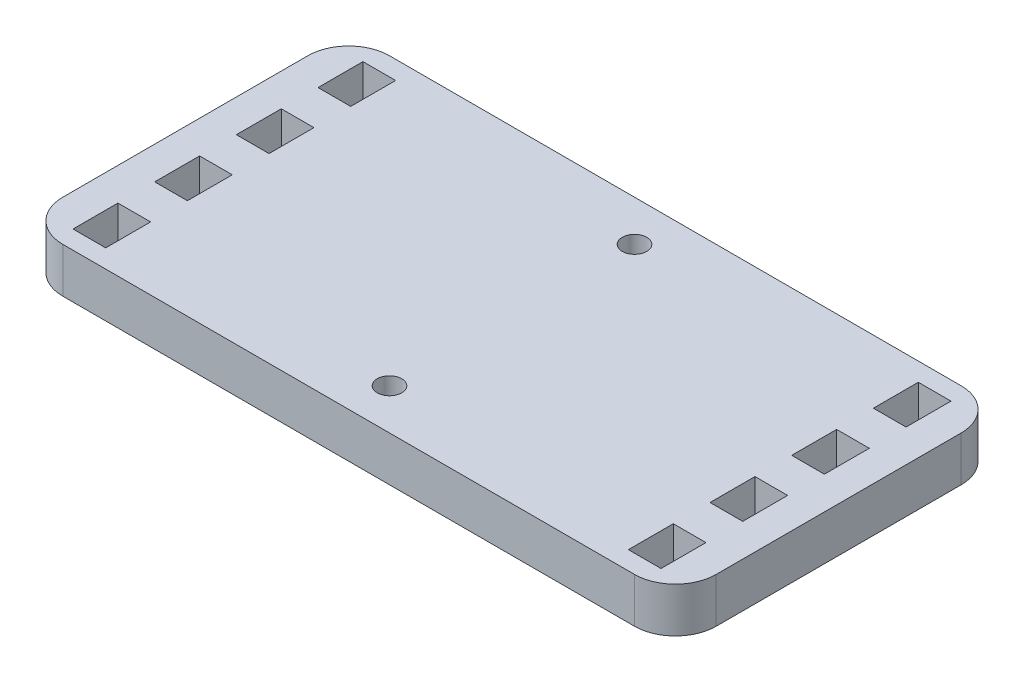
from build123d import *

# Parameters (mm, degrees)
SKETCH1_W           = 80
SKETCH1_H           = 40
SKETCH1_R           = 1.5
BOSS_EXTRUDE1_DEPTH = 5.5
SKETCH2_W           = 4
SKETCH2_H           = 5.5
CUT_EXTRUDE1_DEPTH  = 46.058295574
FILLET1_R           = 5


with BuildPart() as part:
    # Sketch1 → Boss-Extrude1 (new body)
    with BuildSketch(Plane(origin=(0, 0, 0), x_dir=(1, 0, 0), z_dir=(0, 1, 0))):
        Rectangle(SKETCH1_W, SKETCH1_H)
        with Locations((0, 15)):
            Circle(SKETCH1_R, mode=Mode.SUBTRACT)
        with Locations((0, -15)):
            Circle(SKETCH1_R, mode=Mode.SUBTRACT)
    extrude(amount=BOSS_EXTRUDE1_DEPTH)

    # Sketch2 → Cut-Extrude1 (cut, through all)
    with BuildSketch(Plane(origin=(0, 5.5, 0), x_dir=(1, 0, 0), z_dir=(0, 1, 0))):
        with Locations((-34, 5)):
            Rectangle(SKETCH2_W, SKETCH2_H)
        with Locations((-34, 15)):
            Rectangle(SKETCH2_W, SKETCH2_H)
        with Locations((-34, -5)):
            Rectangle(SKETCH2_W, SKETCH2_H)
        with Locations((-34, -15)):
            Rectangle(SKETCH2_W, SKETCH2_H)
        with Locations((34, -15)):
            Rectangle(SKETCH2_W, SKETCH2_H)
        with Locations((34, 15)):
            Rectangle(SKETCH2_W, SKETCH2_H)
        with Locations((34, -5)):
            Rectangle(SKETCH2_W, SKETCH2_H)
        with Locations((34, 5)):
            Rectangle(SKETCH2_W, SKETCH2_H)
    extrude(amount=-CUT_EXTRUDE1_DEPTH, mode=Mode.SUBTRACT)

    # Fillet1
    fillet1_edges = [part.edges().sort_by_distance(p)[0] for p in [
        (40, 2.75, -20),
        (-40, 2.75, -20),
        (-40, 2.75, 20),
        (40, 2.75, 20),
    ]]
    fillet(fillet1_edges, radius=FILLET1_R)


solid = part.part
